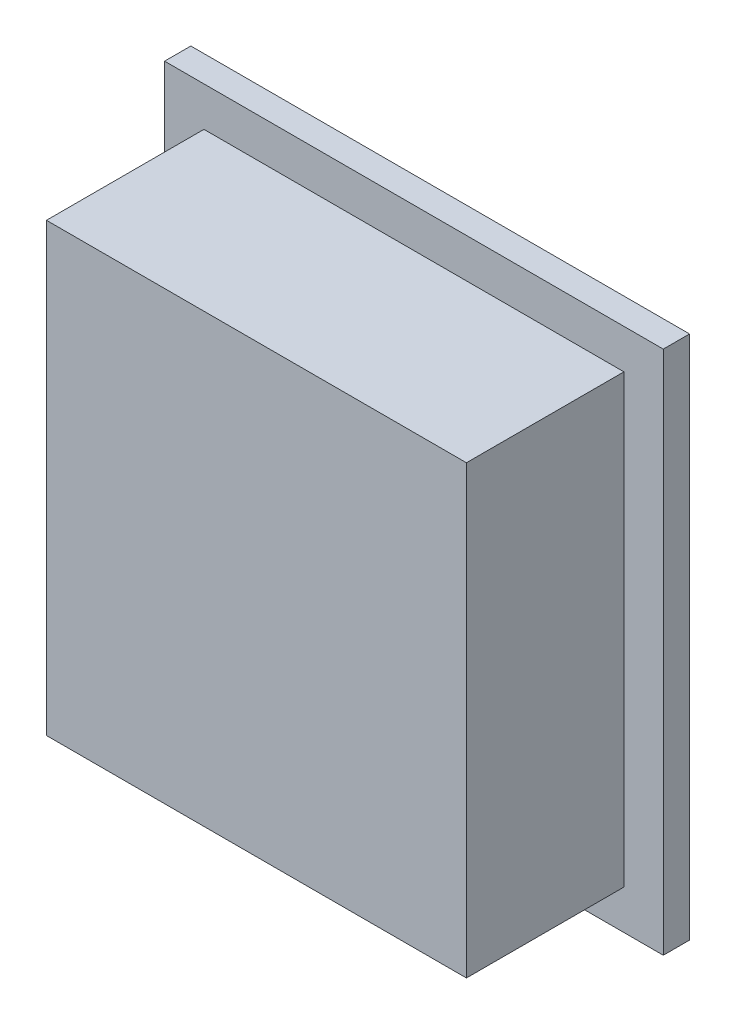
from build123d import *

# Parameters (mm, degrees)
SKETCH_1_W      = 160
SKETCH_1_H      = 170
EXTRUDE_1_DEPTH = 60
SKETCH_2_W      = 190
SKETCH_2_H      = 200
EXTRUDE_2_DEPTH = 10


with BuildPart() as part:
    # 草图1 → 凸台-拉伸1 (new body)
    with BuildSketch(Plane.XY):
        Rectangle(SKETCH_1_W, SKETCH_1_H)
    extrude(amount=EXTRUDE_1_DEPTH)

    # 草图2 → 凸台-拉伸2 (add)
    with BuildSketch(Plane(origin=(0, 0, 0), x_dir=(-1, 0, 0), z_dir=(0, 0, -1))):
        Rectangle(SKETCH_2_W, SKETCH_2_H)
    extrude(amount=EXTRUDE_2_DEPTH)


solid = part.part
